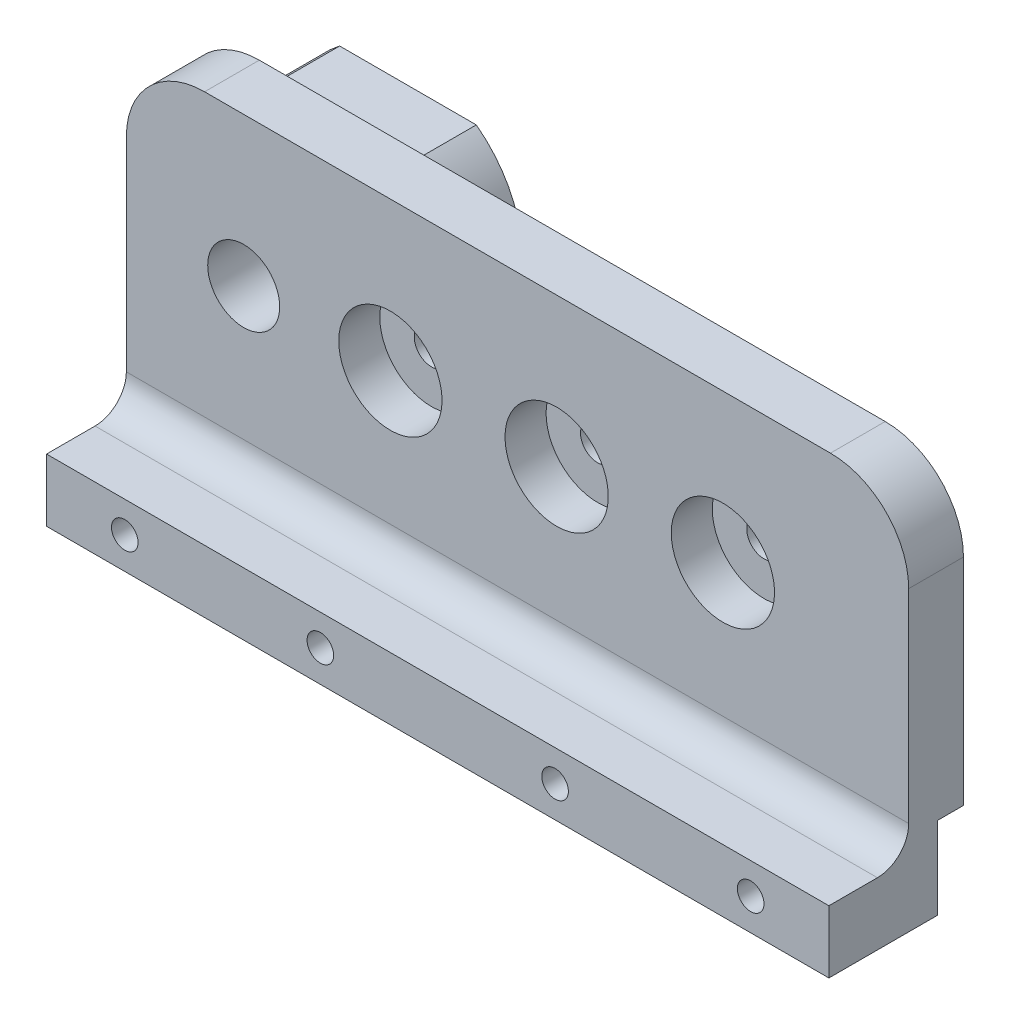
from build123d import *

# Parameters (mm, degrees)
SKETCH1_W           = 100
SKETCH1_H           = 48
BOSS_EXTRUDE1_DEPTH = 7
CUT_EXTRUDE1_REACH  = 113.144
SKETCH2_R           = 4.6
SKETCH2_R_2         = 2.2
SKETCH3_W           = 100
SKETCH3_H           = 8
BOSS_EXTRUDE2_DEPTH = 10.2
SKETCH4_R           = 6.6
CUT_EXTRUDE2_DEPTH  = 5.25
SKETCH5_R           = 2.6
CUT_EXTRUDE3_DEPTH  = 0.1
SKETCH7_R           = 1.7
CUT_EXTRUDE4_DEPTH  = 113.233729333
CUT_EXTRUDE5_REACH  = 114.249
SKETCH8_R           = 1.7
CUT_EXTRUDE6_REACH  = 116.257
SKETCH9_W           = 3.3
SKETCH9_H           = 10.5
BOSS_EXTRUDE3_DEPTH = 14
SHELL1_T            = 2.5
FILLET3_R           = 10
CUT_EXTRUDE7_START  = -3
CUT_EXTRUDE7_DEPTH  = 3.2
CUT_EXTRUDE8_DEPTH  = 5
FILLET4_R           = 4


with BuildPart() as part:
    # Sketch1 → Boss-Extrude1 (new body)
    with BuildSketch(Plane.XY):
        with Locations((50, 24)):
            Rectangle(SKETCH1_W, SKETCH1_H)
    extrude(amount=BOSS_EXTRUDE1_DEPTH)

    # Sketch2 → Cut-Extrude1 (cut, up to next)
    with BuildSketch(Plane.XY.offset(7), mode=Mode.PRIVATE) as cut_extrude1_sk1:
        with Locations((15, 29)):
            Circle(SKETCH2_R)
    cut_extrude1_tool1 = extrude(cut_extrude1_sk1.sketch, amount=-CUT_EXTRUDE1_REACH, mode=Mode.PRIVATE) & part.part
    # Sketch2 → Cut-Extrude1 (cut, up to next)
    with BuildSketch(Plane.XY.offset(7), mode=Mode.PRIVATE) as cut_extrude1_sk2:
        with Locations((33.75, 29)):
            Circle(SKETCH2_R_2)
    cut_extrude1_tool2 = extrude(cut_extrude1_sk2.sketch, amount=-CUT_EXTRUDE1_REACH, mode=Mode.PRIVATE) & part.part
    # Sketch2 → Cut-Extrude1 (cut, up to next)
    with BuildSketch(Plane.XY.offset(7), mode=Mode.PRIVATE) as cut_extrude1_sk3:
        with Locations((55, 29)):
            Circle(SKETCH2_R_2)
    cut_extrude1_tool3 = extrude(cut_extrude1_sk3.sketch, amount=-CUT_EXTRUDE1_REACH, mode=Mode.PRIVATE) & part.part
    # Sketch2 → Cut-Extrude1 (cut, up to next)
    with BuildSketch(Plane.XY.offset(7), mode=Mode.PRIVATE) as cut_extrude1_sk4:
        with Locations((76.25, 29)):
            Circle(SKETCH2_R_2)
    cut_extrude1_tool4 = extrude(cut_extrude1_sk4.sketch, amount=-CUT_EXTRUDE1_REACH, mode=Mode.PRIVATE) & part.part
    add(cut_extrude1_tool1.solids().sort_by_distance((15, 29, 7))[0], mode=Mode.SUBTRACT)
    add(cut_extrude1_tool2.solids().sort_by_distance((33.75, 29, 7))[0], mode=Mode.SUBTRACT)
    add(cut_extrude1_tool3.solids().sort_by_distance((55, 29, 7))[0], mode=Mode.SUBTRACT)
    add(cut_extrude1_tool4.solids().sort_by_distance((76.25, 29, 7))[0], mode=Mode.SUBTRACT)

    # Sketch3 → Boss-Extrude2 (add)
    with BuildSketch(Plane(origin=(0, 0, 0), x_dir=(-1, 0, 0), z_dir=(0, 0, -1))):
        with Locations((-50, 4)):
            Rectangle(SKETCH3_W, SKETCH3_H)
    extrude(amount=BOSS_EXTRUDE2_DEPTH)

    # Sketch4 → Cut-Extrude2 (cut)
    with BuildSketch(Plane(origin=(0, 0, 0), x_dir=(-1, 0, 0), z_dir=(0, 0, -1))):
        with Locations((-76.25, 29)):
            Circle(SKETCH4_R)
        with Locations((-55, 29)):
            Circle(SKETCH4_R)
        with Locations((-33.75, 29)):
            Circle(SKETCH4_R)
    extrude(amount=-CUT_EXTRUDE2_DEPTH, mode=Mode.SUBTRACT)

    # Sketch5 → Cut-Extrude3 (cut)
    with BuildSketch(Plane.XY.offset(7)):
        with Locations((35.000022648, 4.052132501)):
            Circle(SKETCH5_R)
        with Locations((64.999977352, 4)):
            Circle(SKETCH5_R)
    extrude(amount=-CUT_EXTRUDE3_DEPTH, mode=Mode.SUBTRACT)

    # Sketch7 → Cut-Extrude4 (cut, through all)
    with BuildSketch(Plane.XY.offset(6.9)):
        with Locations((35.000022648, 4.052132501)):
            Circle(SKETCH7_R)
        with Locations((64.999977352, 4)):
            Circle(SKETCH7_R)
    extrude(amount=-CUT_EXTRUDE4_DEPTH, mode=Mode.SUBTRACT)

    # Sketch8 → Cut-Extrude5 (cut, up to next)
    with BuildSketch(Plane.XY.offset(7), mode=Mode.PRIVATE) as cut_extrude5_sk1:
        with Locations((10, 4.052132501)):
            Circle(SKETCH8_R)
    cut_extrude5_tool1 = extrude(cut_extrude5_sk1.sketch, amount=-CUT_EXTRUDE5_REACH, mode=Mode.PRIVATE) & part.part
    # Sketch8 → Cut-Extrude5 (cut, up to next)
    with BuildSketch(Plane.XY.offset(7), mode=Mode.PRIVATE) as cut_extrude5_sk2:
        with Locations((90, 4.052132501)):
            Circle(SKETCH8_R)
    cut_extrude5_tool2 = extrude(cut_extrude5_sk2.sketch, amount=-CUT_EXTRUDE5_REACH, mode=Mode.PRIVATE) & part.part
    add(cut_extrude5_tool1.solids().sort_by_distance((10, 4.052133, 7))[0], mode=Mode.SUBTRACT)
    add(cut_extrude5_tool2.solids().sort_by_distance((90, 4.052133, 7))[0], mode=Mode.SUBTRACT)


with BuildPart() as body_2:
    # Mirror1: mirrored copy
    add(part.part.mirror(Plane.XY.offset(-10.2)))

    # Sketch9 → Cut-Extrude6 (cut, up to next)
    with BuildSketch(Plane(origin=(100, 0, 0), x_dir=(0, 0, -1), z_dir=(1, 0, 0)), mode=Mode.PRIVATE) as cut_extrude6_sk1:
        with Locations((25.75, 5.25)):
            Rectangle(SKETCH9_W, SKETCH9_H)
    cut_extrude6_tool1 = extrude(cut_extrude6_sk1.sketch, amount=-CUT_EXTRUDE6_REACH, mode=Mode.PRIVATE) & body_2.part
    add(cut_extrude6_tool1.solids().sort_by_distance((100, 5.25, -25.75))[0], mode=Mode.SUBTRACT)


with BuildPart() as body_2_2:
    # Sketch10 → Boss-Extrude3 (new body)
    with BuildSketch(Plane(origin=(0, 0, -27.4), x_dir=(-1, 0, 0), z_dir=(0, 0, -1))):
        with BuildLine():
            Line((-7.140610711, 38.2), (-22.859389289, 38.2))
            ThreePointArc((-22.859389289, 38.2), (-27.1, 29), (-22.859389289, 19.8))
            Line((-22.859389289, 19.8), (-7.140610711, 19.8))
            ThreePointArc((-7.140610711, 19.8), (-2.9, 29), (-7.140610711, 38.2))
        make_face()
    extrude(amount=BOSS_EXTRUDE3_DEPTH)

    # Shell1
    shell1_openings = [body_2_2.faces().sort_by_distance(p)[0] for p in [
        (15, 29, -27.4),
        (15, 29, -41.4),
    ]]
    offset(amount=SHELL1_T, openings=shell1_openings, kind=Kind.INTERSECTION)


with BuildPart() as body_2_1:
    add(body_2.part)

    # Combine1: union body 2 2
    add(body_2_2.part)

    # Fillet3
    fillet3_edges = [body_2_1.edges().sort_by_distance(p)[0] for p in [
        (0, 48, -23.9),
        (100, 48, -23.9),
    ]]
    fillet(fillet3_edges, radius=FILLET3_R)

    # Sketch11 → Cut-Extrude7 (cut)
    with BuildSketch(Plane(origin=(0, 0, -24.1), x_dir=(-1, 0, 0), z_dir=(0, 0, -1)).offset(CUT_EXTRUDE7_START)):
        Polygon((-60.958525467, 4), (-60.958525467, 0), (-69.041429236, 0), (-69.041429236, 4), (-67.020703294, 7.5), (-62.97925141, 7.5), align=None)
        Polygon((-38.981277106, 4.052132501), (-38.981277106, 0), (-31.018768191, 0), (-31.018768191, 4.052132501), (-33.009395419, 7.5), (-36.990649877, 7.5), align=None)
    extrude(amount=-CUT_EXTRUDE7_DEPTH, mode=Mode.SUBTRACT)

    # Sketch12 → Cut-Extrude8 (cut)
    with BuildSketch(Plane(origin=(0, 0, -24.1), x_dir=(-1, 0, 0), z_dir=(0, 0, -1))):
        Polygon((-87.979274058, 0.552132501), (-85.958548116, 4.052132501), (-87.979274058, 7.552132501), (-92.020725942, 7.552132501), (-94.041451884, 4.052132501), (-92.020725942, 0.552132501), align=None)
        Polygon((-7.979274058, 0.552132501), (-5.958548116, 4.052132501), (-7.979274058, 7.552132501), (-12.020725942, 7.552132501), (-14.041451884, 4.052132501), (-12.020725942, 0.552132501), align=None)
    extrude(amount=-CUT_EXTRUDE8_DEPTH, mode=Mode.SUBTRACT)

    # Fillet4
    fillet4_edges = [body_2_1.edges().sort_by_distance(p)[0] for p in [
        (50, 8, -20.4),
    ]]
    fillet(fillet4_edges, radius=FILLET4_R)


solid = body_2_1.part
